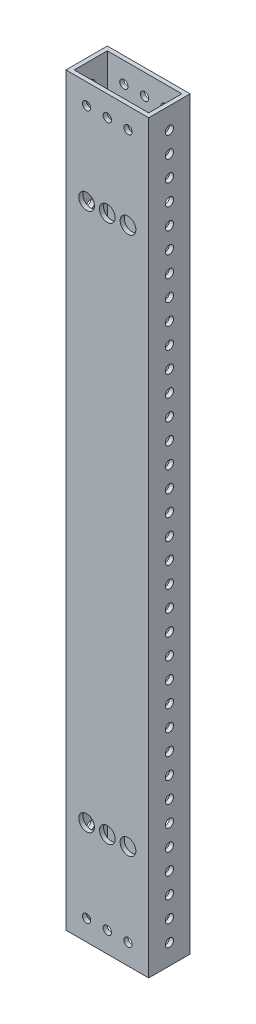
from build123d import *

# Parameters (mm, degrees)
SKETCH1_W           = 50.8
SKETCH1_H           = 25.4
SKETCH1_W_2         = 45.72
SKETCH1_H_2         = 20.32
BOSS_EXTRUDE1_DEPTH = 457.2
SKETCH3_R           = 2.54
CUT_EXTRUDE1_DEPTH  = 457.2
SKETCH4_R           = 2.54
SKETCH4_R_2         = 4.826
CUT_EXTRUDE3_DEPTH  = 457.2


with BuildPart() as part:
    # Sketch1 → Boss-Extrude1 (new body)
    with BuildSketch(Plane(origin=(0, 0, 0), x_dir=(1, 0, 0), z_dir=(0, 1, 0))):
        with Locations((-21.472101782, 11.503789329)):
            Rectangle(SKETCH1_W, SKETCH1_H)
        with Locations((-21.472101782, 11.503789329)):
            Rectangle(SKETCH1_W_2, SKETCH1_H_2, mode=Mode.SUBTRACT)
    extrude(amount=BOSS_EXTRUDE1_DEPTH)

    # Sketch3 → Cut-Extrude1 (cut)
    with BuildSketch(Plane(origin=(3.927898218, 0, 0), x_dir=(0, 0, -1), z_dir=(1, 0, 0))):
        with Locations((11.503789329, 444.246)):
            Circle(SKETCH3_R)
        with Locations((11.503789329, 431.546)):
            Circle(SKETCH3_R)
        with Locations((11.503789329, 418.846)):
            Circle(SKETCH3_R)
        with Locations((11.503789329, 406.146)):
            Circle(SKETCH3_R)
        with Locations((11.503789329, 393.446)):
            Circle(SKETCH3_R)
        with Locations((11.503789329, 380.746)):
            Circle(SKETCH3_R)
        with Locations((11.503789329, 368.046)):
            Circle(SKETCH3_R)
        with Locations((11.503789329, 355.346)):
            Circle(SKETCH3_R)
        with Locations((11.503789329, 342.646)):
            Circle(SKETCH3_R)
        with Locations((11.503789329, 329.946)):
            Circle(SKETCH3_R)
        with Locations((11.503789329, 317.246)):
            Circle(SKETCH3_R)
        with Locations((11.503789329, 304.546)):
            Circle(SKETCH3_R)
        with Locations((11.503789329, 291.846)):
            Circle(SKETCH3_R)
        with Locations((11.503789329, 279.146)):
            Circle(SKETCH3_R)
        with Locations((11.503789329, 266.446)):
            Circle(SKETCH3_R)
        with Locations((11.503789329, 253.746)):
            Circle(SKETCH3_R)
        with Locations((11.503789329, 241.046)):
            Circle(SKETCH3_R)
        with Locations((11.503789329, 228.346)):
            Circle(SKETCH3_R)
        with Locations((11.503789329, 215.646)):
            Circle(SKETCH3_R)
        with Locations((11.503789329, 202.946)):
            Circle(SKETCH3_R)
        with Locations((11.503789329, 190.246)):
            Circle(SKETCH3_R)
        with Locations((11.503789329, 177.546)):
            Circle(SKETCH3_R)
        with Locations((11.503789329, 164.846)):
            Circle(SKETCH3_R)
        with Locations((11.503789329, 152.146)):
            Circle(SKETCH3_R)
        with Locations((11.503789329, 139.446)):
            Circle(SKETCH3_R)
        with Locations((11.503789329, 126.746)):
            Circle(SKETCH3_R)
        with Locations((11.503789329, 114.046)):
            Circle(SKETCH3_R)
        with Locations((11.503789329, 101.346)):
            Circle(SKETCH3_R)
        with Locations((11.503789329, 88.646)):
            Circle(SKETCH3_R)
        with Locations((11.503789329, 75.946)):
            Circle(SKETCH3_R)
        with Locations((11.503789329, 63.246)):
            Circle(SKETCH3_R)
        with Locations((11.503789329, 50.546)):
            Circle(SKETCH3_R)
        with Locations((11.503789329, 37.846)):
            Circle(SKETCH3_R)
        with Locations((11.503789329, 25.146)):
            Circle(SKETCH3_R)
        with Locations((11.503789329, 12.446)):
            Circle(SKETCH3_R)
    extrude(amount=-CUT_EXTRUDE1_DEPTH, mode=Mode.SUBTRACT)

    # Sketch4 → Cut-Extrude3 (cut)
    with BuildSketch(Plane(origin=(0, 0, -24.203789329), x_dir=(-1, 0, 0), z_dir=(0, 0, -1))):
        with Locations((34.172101782, 444.5)):
            Circle(SKETCH4_R)
        with Locations((21.472101782, 444.5)):
            Circle(SKETCH4_R)
        with Locations((8.772101782, 444.5)):
            Circle(SKETCH4_R)
        with Locations((8.772101782, 393.7)):
            Circle(SKETCH4_R_2)
        with Locations((21.472101782, 393.7)):
            Circle(SKETCH4_R_2)
        with Locations((34.172101782, 393.7)):
            Circle(SKETCH4_R_2)
        with Locations((34.172101782, 12.7)):
            Circle(SKETCH4_R)
        with Locations((21.472101782, 12.7)):
            Circle(SKETCH4_R)
        with Locations((8.772101782, 12.7)):
            Circle(SKETCH4_R)
        with Locations((34.172101782, 63.5)):
            Circle(SKETCH4_R_2)
        with Locations((21.472101782, 63.5)):
            Circle(SKETCH4_R_2)
        with Locations((8.772101782, 63.5)):
            Circle(SKETCH4_R_2)
    extrude(amount=-CUT_EXTRUDE3_DEPTH, mode=Mode.SUBTRACT)


solid = part.part
